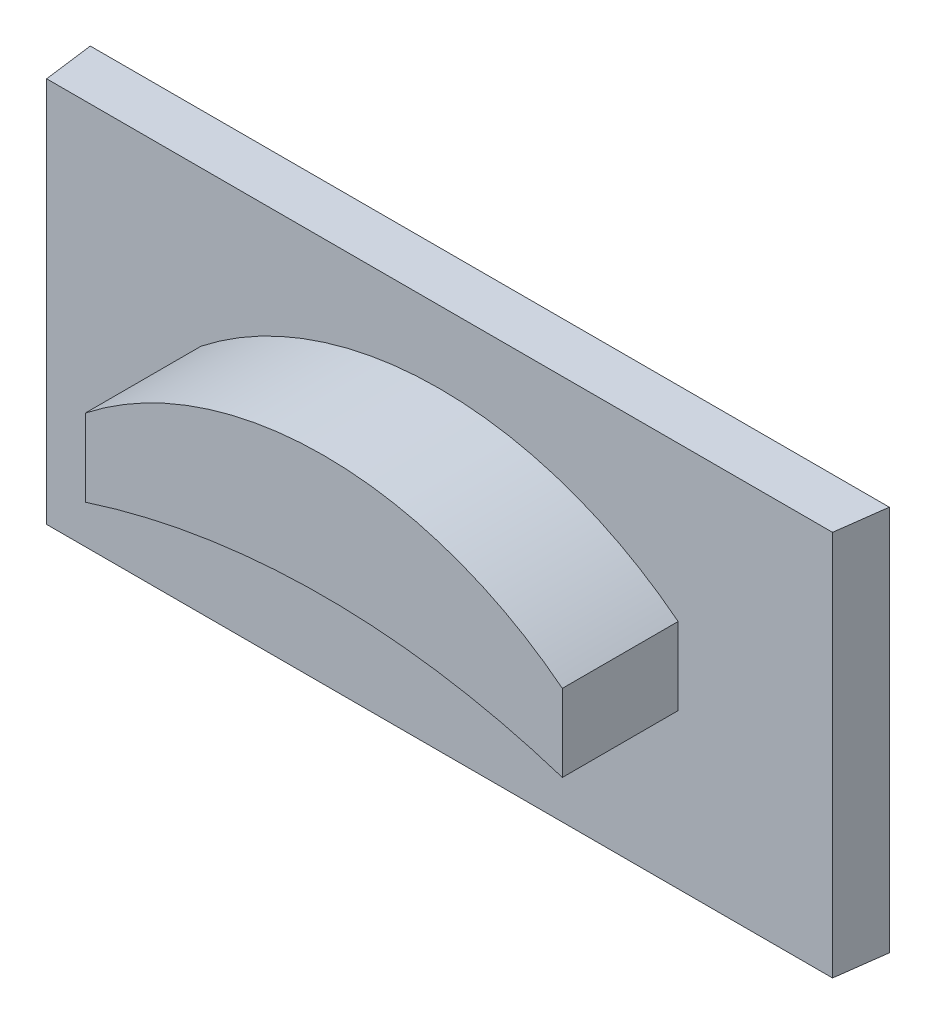
from build123d import *

# Parameters (mm, degrees)
RESSALTO_EXTRUS_O1_DEPTH = 10
RESSALTO_EXTRUS_O2_DEPTH = 3


with BuildPart() as part:
    # Esboço1 → Ressalto-extrusão1 (new body)
    with BuildSketch(Plane(origin=(0, 0, 0), x_dir=(1, 0, 0), z_dir=(0, 1, 0))):
        Polygon((10.162691683, 85.099878857), (10.333844345, 86.399912395), (-10.365601698, 86.395859306), (-10.19445786, 85.095892792), align=None)
    extrude(amount=RESSALTO_EXTRUS_O1_DEPTH)

    # Esboço2 → Ressalto-extrusão2 (add)
    with BuildSketch(Plane(origin=(-0.016662731, 0, -85.097885672), x_dir=(0.99999998082988, 0, -0.00019580663883939192), z_dir=(0.00019580663883939195, 0, 0.9999999808298801))):
        with BuildLine():
            Line((-6.177795324, 6), (-6.177795324, 4))
            ThreePointArc((-6.177795324, 4), (0.000779643, 4.978296307), (6.179354609, 4))
            Line((6.179354609, 4), (6.179354609, 6))
            ThreePointArc((6.179354609, 6), (0.000779643, 8.137099048), (-6.177795324, 6))
        make_face()
    extrude(amount=RESSALTO_EXTRUS_O2_DEPTH)


solid = part.part
